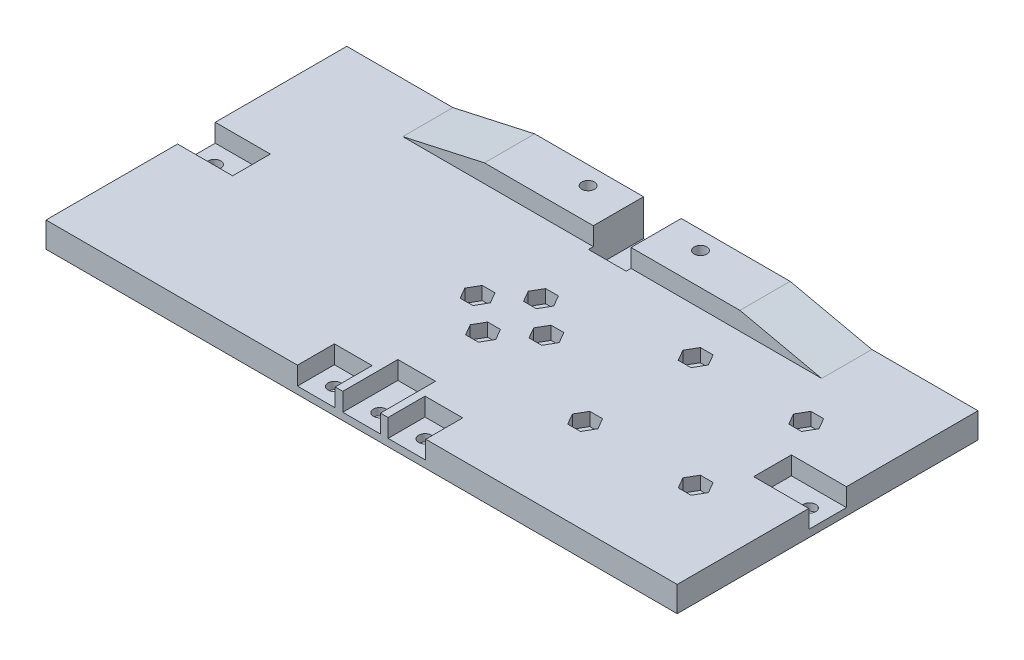
from build123d import *
from build123d.topology import SkipClean

# Parameters (mm, degrees)
SKETCH1_W           = 174.17
SKETCH1_H           = 83
BOSS_EXTRUDE1_DEPTH = 7
SKETCH2_R           = 1.75
CUT_EXTRUDE1_DEPTH  = 194.062655374
SKETCH3_R           = 1.75
CUT_EXTRUDE2_DEPTH  = 194.062655374
SKETCH4_W           = 15.4
SKETCH4_H           = 10.4
SKETCH4_W_2         = 10.4
SKETCH4_H_2         = 15.4
CUT_EXTRUDE3_DEPTH  = 5
SKETCH5_W           = 10.4
SKETCH5_H           = 10.4
CUT_EXTRUDE4_DEPTH  = 5
SKETCH6_R           = 1.75
CUT_EXTRUDE5_DEPTH  = 194.000489378
SKETCH12_R          = 1.75
CUT_EXTRUDE9_DEPTH  = 194.062655374
CUT_EXTRUDE6_DEPTH  = 3.64
SKETCH9_W           = 10.4
SKETCH9_H           = 10.4
CUT_EXTRUDE7_DEPTH  = 5
SKETCH10_R          = 1.75
CUT_EXTRUDE8_DEPTH  = 194.000489378
SKETCH13_W          = 20.6
SKETCH13_H          = 13.86
SKETCH13_R          = 1.75
BOSS_EXTRUDE2_DEPTH = 5
CHAMFER1_SIZE       = 7.094229205
CHAMFER1_SIZE_2     = 32
MIRROR1_START       = -76.250259333
MIRROR1_DEPTH       = 7.110259333
MIRROR1_START_2     = -83
MIRROR1_2_DEPTH     = 3.2499999
MIRROR1_START_3     = -79.7500001
MIRROR1_3_DEPTH     = 3.499740767
MIRROR1_START_4     = 7
MIRROR1_4_OUTLINE_R = 1.75
MIRROR1_4_DEPTH     = 5


with BuildPart() as part:
    # Sketch1 → Boss-Extrude1 (new body)
    with BuildSketch(Plane(origin=(0, 0, 0), x_dir=(1, 0, 0), z_dir=(0, 1, 0))):
        with Locations((87.085, 41.5)):
            Rectangle(SKETCH1_W, SKETCH1_H)
    extrude(amount=BOSS_EXTRUDE1_DEPTH)

    # Sketch2 → Cut-Extrude1 (cut, through all)
    with BuildSketch(Plane(origin=(0, 7, 0), x_dir=(1, 0, 0), z_dir=(0, 1, 0))):
        with Locations(Location((87.085, 49.5, 0), (0, 0, 270))):
            Circle(SKETCH2_R)
        with Locations(Location((77.585, 41.5, 0), (0, 0, 270))):
            Circle(SKETCH2_R)
        with Locations(Location((96.585, 41.5, 0), (0, 0, 270))):
            Circle(SKETCH2_R)
        with Locations(Location((87.085, 33.5, 0), (0, 0, 270))):
            Circle(SKETCH2_R)
    extrude(amount=-CUT_EXTRUDE1_DEPTH, mode=Mode.SUBTRACT)

    # Sketch3 → Cut-Extrude2 (cut, through all)
    with BuildSketch(Plane(origin=(0, 7, 0), x_dir=(1, 0, 0), z_dir=(0, 1, 0))):
        with Locations(Location((87.085, 78, 0), (0, 0, 270))):
            Circle(SKETCH3_R)
        with Locations(Location((5, 41.5, 0), (0, 0, 270))):
            Circle(SKETCH3_R)
        with Locations(Location((87.085, 5, 0), (0, 0, 270))):
            Circle(SKETCH3_R)
        with Locations(Location((169.17, 41.5, 0), (0, 0, 270))):
            Circle(SKETCH3_R)
    extrude(amount=-CUT_EXTRUDE2_DEPTH, mode=Mode.SUBTRACT)

    # Sketch4 → Cut-Extrude3 (cut)
    with BuildSketch(Plane(origin=(0, 7, 0), x_dir=(1, 0, 0), z_dir=(0, 1, 0))):
        with Locations((7.5, 41.5)):
            Rectangle(SKETCH4_W, SKETCH4_H)
        with Locations((87.085, 7.5)):
            Rectangle(SKETCH4_W_2, SKETCH4_H_2)
        with Locations((87.085, 75.5)):
            Rectangle(SKETCH4_W_2, SKETCH4_H_2)
        with Locations((166.67, 41.5)):
            Rectangle(SKETCH4_W, SKETCH4_H)
    extrude(amount=-CUT_EXTRUDE3_DEPTH, mode=Mode.SUBTRACT)

    # Sketch5 → Cut-Extrude4 (cut)
    with BuildSketch(Plane(origin=(0, 7, 0), x_dir=(1, 0, 0), z_dir=(0, 1, 0))):
        with Locations((74.585, 5)):
            Rectangle(SKETCH5_W, SKETCH5_H)
        with Locations((99.585, 5)):
            Rectangle(SKETCH5_W, SKETCH5_H)
    extrude(amount=-CUT_EXTRUDE4_DEPTH, mode=Mode.SUBTRACT)

    # Sketch6 → Cut-Extrude5 (cut, through all)
    with BuildSketch(Plane(origin=(0, 2, 0), x_dir=(1, 0, 0), z_dir=(0, 1, 0))):
        with Locations(Location((74.585, 5, 0), (0, 0, 270))):
            Circle(SKETCH6_R)
        with Locations(Location((99.585, 5, 0), (0, 0, 270))):
            Circle(SKETCH6_R)
    extrude(amount=-CUT_EXTRUDE5_DEPTH, mode=Mode.SUBTRACT)

    # Sketch12 → Cut-Extrude9 (cut, through all)
    with BuildSketch(Plane.XZ):
        with Locations(Location((122.51393219, -26.25, 0), (0, 0, 270))):
            Circle(SKETCH12_R)
        with Locations(Location((153.01393219, -26.25, 0), (0, 0, 270))):
            Circle(SKETCH12_R)
        with Locations(Location((122.51393219, -56.75, 0), (0, 0, 270))):
            Circle(SKETCH12_R)
        with Locations(Location((153.01393219, -56.75, 0), (0, 0, 270))):
            Circle(SKETCH12_R)
    extrude(amount=-CUT_EXTRUDE9_DEPTH, mode=Mode.SUBTRACT)

    # Sketch7 → Cut-Extrude6 (cut)
    with BuildSketch(Plane(origin=(0, 7, 0), x_dir=(1, 0, 0), z_dir=(0, 1, 0))):
        Polygon((75.824081679, 44.55), (79.345918321, 44.55), (81.106836642, 41.5), (79.345918321, 38.45), (75.824081679, 38.45), (74.063163358, 41.5), align=None)
        Polygon((85.324081679, 52.55), (88.845918321, 52.55), (90.606836642, 49.5), (88.845918321, 46.45), (85.324081679, 46.45), (83.563163358, 49.5), align=None)
        Polygon((100.106836642, 41.5), (98.345918321, 44.55), (94.824081679, 44.55), (93.063163358, 41.5), (94.824081679, 38.45), (98.345918321, 38.45), align=None)
        Polygon((83.563163358, 33.5), (85.324081679, 30.45), (88.845918321, 30.45), (90.606836642, 33.5), (88.845918321, 36.55), (85.324081679, 36.55), align=None)
        Polygon((120.753013869, 29.3), (124.274850511, 29.3), (126.035768832, 26.25), (124.274850511, 23.2), (120.753013869, 23.2), (118.992095548, 26.25), align=None)
        Polygon((151.253013869, 29.3), (154.774850511, 29.3), (156.535768832, 26.25), (154.774850511, 23.2), (151.253013869, 23.2), (149.492095548, 26.25), align=None)
        Polygon((151.253013869, 59.8), (154.774850511, 59.8), (156.535768832, 56.75), (154.774850511, 53.7), (151.253013869, 53.7), (149.492095548, 56.75), align=None)
        Polygon((120.753013869, 59.8), (124.274850511, 59.8), (126.035768832, 56.75), (124.274850511, 53.7), (120.753013869, 53.7), (118.992095548, 56.75), align=None)
    extrude(amount=-CUT_EXTRUDE6_DEPTH, mode=Mode.SUBTRACT)

    # Sketch9 → Cut-Extrude7 (cut)
    with BuildSketch(Plane.XZ):
        with Locations((71.585, -78)):
            Rectangle(SKETCH9_W, SKETCH9_H)
        with Locations((102.585, -78)):
            Rectangle(SKETCH9_W, SKETCH9_H)
    extrude(amount=-CUT_EXTRUDE7_DEPTH, mode=Mode.SUBTRACT)

    # Sketch10 → Cut-Extrude8 (cut, through all)
    with BuildSketch(Plane.XZ.offset(-5)):
        with Locations(Location((71.585, -78, 0), (0, 0, 270))):
            Circle(SKETCH10_R)
        with Locations(Location((102.585, -78, 0), (0, 0, 270))):
            Circle(SKETCH10_R)
    extrude(amount=-CUT_EXTRUDE8_DEPTH, mode=Mode.SUBTRACT)

    # Sketch13 → Boss-Extrude2 (add)
    with BuildSketch(Plane(origin=(0, 7, 0), x_dir=(1, 0, 0), z_dir=(0, 1, 0))):
        with Locations((71.585, 76.07)):
            Rectangle(SKETCH13_W, SKETCH13_H)
        with Locations(Location((71.585, 78, 0), (0, 0, 90))):
            Circle(SKETCH13_R, mode=Mode.SUBTRACT)
    extrude(amount=BOSS_EXTRUDE2_DEPTH)

    # Chamfer1
    # the kernel refuses this chamfer: 32, 7.094229205 mm, written as the material it adds along each edge
    with BuildSketch(Plane(origin=(61.285, 7, -83), x_dir=(0, 1, 0), z_dir=(0, 0, 1))) as chamfer1_piece_1_section:
        Polygon((CHAMFER1_SIZE, 0), (0, CHAMFER1_SIZE_2), (0, 0), align=None)
    chamfer1_piece_1 = extrude(amount=13.86, mode=Mode.PRIVATE)
    chamfer1_piece_1 = split(chamfer1_piece_1, bisect_by=Plane(origin=(61.285, 12, -83), z_dir=(0, -1, 0)), keep=Keep.TOP, mode=Mode.PRIVATE)
    add(chamfer1_piece_1)

    # Mirror1: read off the stored shape, not the designer's step
    # Mirror1 outline → Mirror1 (add)
    with BuildSketch(Plane.XY.offset(MIRROR1_START)):
        Polygon((92.285, 12), (92.285, 7), (144.885, 7), (122.331457482, 12), align=None)
    extrude(amount=MIRROR1_DEPTH)

    # Mirror1 2 outline → Mirror1 2 (add)
    with BuildSketch(Plane.XY.offset(MIRROR1_START_2)):
        Polygon((92.285, 12), (92.285, 7), (144.885, 7), (122.331457482, 12), align=None)
    extrude(amount=MIRROR1_2_DEPTH)

    # Mirror1 3 outline → Mirror1 3 (add)
    with BuildSketch(Plane.XY.offset(MIRROR1_START_3)):
        Polygon((92.285, 12), (92.285, 7), (144.885, 7), (122.331457482, 12), align=None)
    extrude(amount=MIRROR1_3_DEPTH)

    # Mirror1 4 outline → Mirror1 4 (cut)
    with SkipClean():  # the faces are left unmerged after this step: merging them gives an invalid solid
        with BuildSketch(Plane(origin=(0, 0, 0), x_dir=(1, 0, 0), z_dir=(0, 1, 0)).offset(MIRROR1_START_4)):
            with Locations((102.585, 78)):
                Circle(MIRROR1_4_OUTLINE_R)
        extrude(amount=MIRROR1_4_DEPTH, mode=Mode.SUBTRACT)
    add(part.part.scale(1), mode=Mode.REPLACE)  # the faces are merged on a copy


solid = part.part
